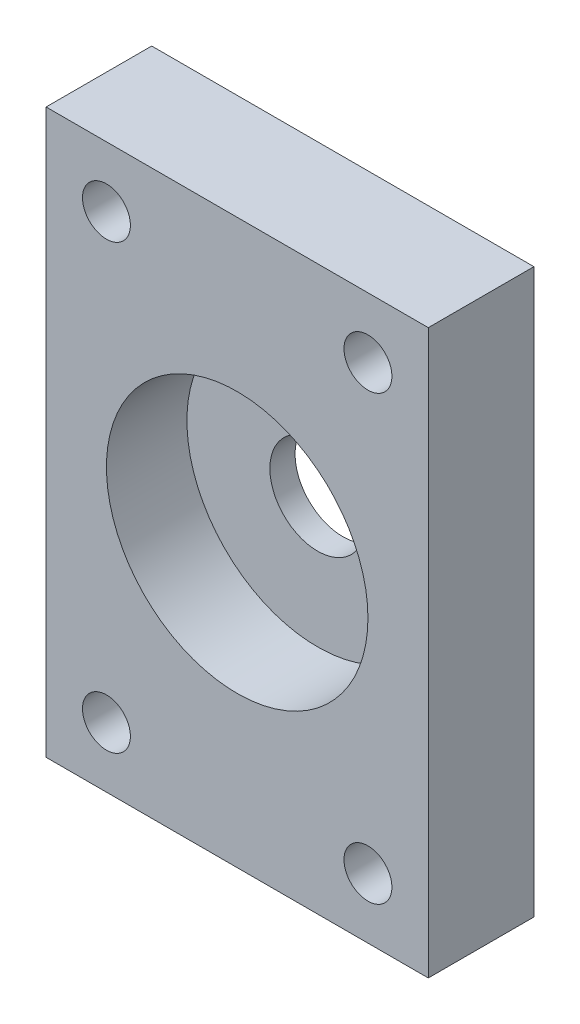
from build123d import *

# Parameters (mm, degrees)
CROQUIS1_R              = 18
CROQUIS1_R_2            = 13
SALIENTE_EXTRUIR1_DEPTH = 8
CROQUIS2_W              = 38
CROQUIS2_H              = 56
CROQUIS2_R              = 18
SALIENTE_EXTRUIR2_DEPTH = 8
CROQUIS5_W              = 38
CROQUIS5_H              = 56
CROQUIS5_R              = 4.75
SALIENTE_EXTRUIR3_DEPTH = 2.5
CROQUIS7_R              = 2.38125
CORTAR_EXTRUIR3_DEPTH   = 36.429507476


with BuildPart() as part:
    # Croquis1 → Saliente-Extruir1 (new body)
    with BuildSketch(Plane.XY):
        Circle(CROQUIS1_R)
        Circle(CROQUIS1_R_2, mode=Mode.SUBTRACT)
    extrude(amount=SALIENTE_EXTRUIR1_DEPTH)

    # Croquis2 → Saliente-Extruir2 (add)
    with BuildSketch(Plane(origin=(0, 0, 0), x_dir=(-1, 0, 0), z_dir=(0, 0, -1))):
        Rectangle(CROQUIS2_W, CROQUIS2_H)
        Circle(CROQUIS2_R, mode=Mode.SUBTRACT)
    extrude(amount=-SALIENTE_EXTRUIR2_DEPTH)

    # Croquis5 → Saliente-Extruir3 (add)
    with BuildSketch(Plane(origin=(0, 0, 0), x_dir=(-1, 0, 0), z_dir=(0, 0, -1))):
        Rectangle(CROQUIS5_W, CROQUIS5_H)
        Circle(CROQUIS5_R, mode=Mode.SUBTRACT)
    extrude(amount=SALIENTE_EXTRUIR3_DEPTH)

    # Croquis7 → Cortar-Extruir3 (cut, through all)
    with BuildSketch(Plane(origin=(0, 0, -2.5), x_dir=(-1, 0, 0), z_dir=(0, 0, -1))):
        with Locations((-13, 22)):
            Circle(CROQUIS7_R)
        with Locations((13, 22)):
            Circle(CROQUIS7_R)
        with Locations((13, -22)):
            Circle(CROQUIS7_R)
        with Locations((-13, -22)):
            Circle(CROQUIS7_R)
    extrude(amount=-CORTAR_EXTRUIR3_DEPTH, mode=Mode.SUBTRACT)


solid = part.part
